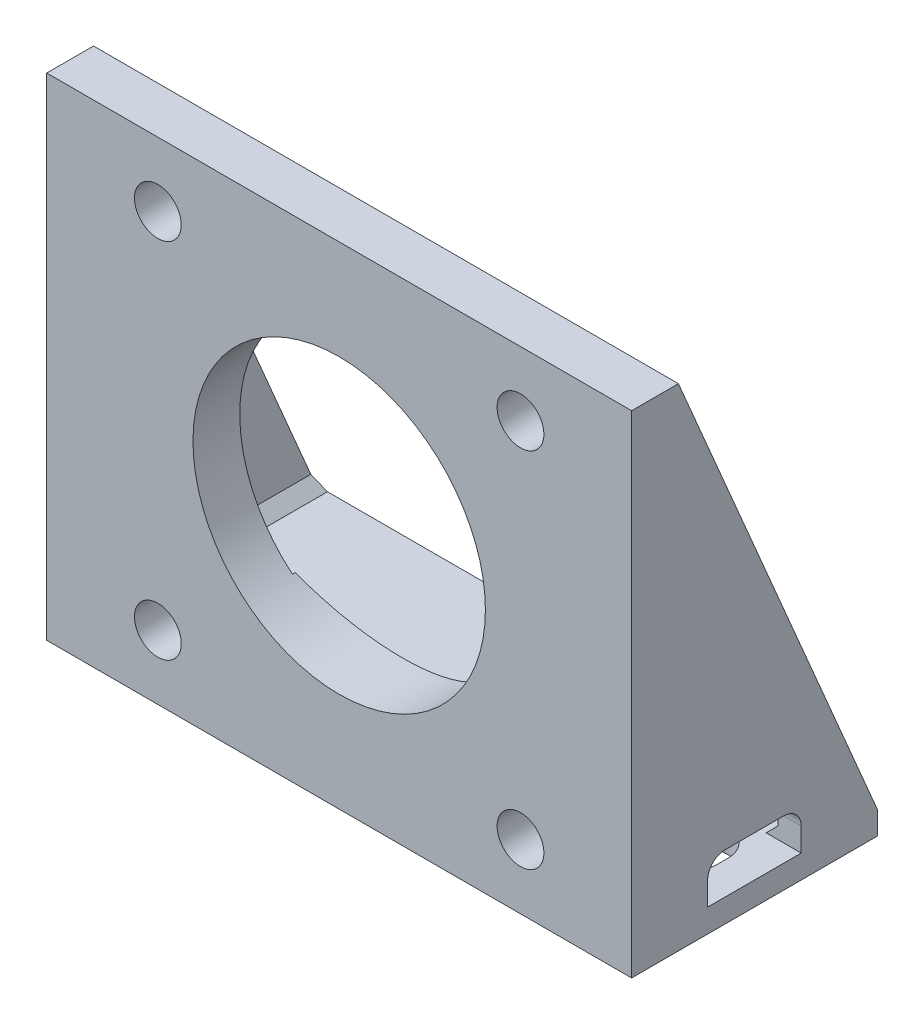
from build123d import *
from OCP.BRepFilletAPI import BRepFilletAPI_MakeChamfer

# Parameters (mm, degrees)
SKETCH1_W                = 50
SKETCH1_H                = 21
BOSS_EXTRUDE1_DEPTH      = 2
SKETCH2_W                = 50
SKETCH2_H                = 42
SKETCH2_R                = 2
SKETCH2_R_2              = 12.5
BOSS_EXTRUDE2_DEPTH      = 4
BOSS_EXTRUDE3_START      = -50
BOSS_EXTRUDE3_DEPTH      = 50
CUT_EXTRUDE1_START       = -17
SKETCH4_W                = 46
SKETCH4_H                = 40
CUT_EXTRUDE1_DEPTH       = 17
BOSS_EXTRUDE4_DEPTH      = 8
BOSS_EXTRUDE4_DEPTH_BACK = 8
SKETCH6_R                = 12.5
CUT_EXTRUDE2_DEPTH       = 68.475921631
CHAMFER1_SIZE            = 1
CHAMFER1_SIZE2           = 1.795054936
CHAMFER2_SIZE            = 2


with BuildPart() as part:
    # Sketch1 → Boss-Extrude1 (new body)
    with BuildSketch(Plane(origin=(0, 0, 0), x_dir=(1, 0, 0), z_dir=(0, 1, 0))):
        with Locations((25, 10.5)):
            Rectangle(SKETCH1_W, SKETCH1_H)
        with BuildLine():
            Line((7.25, 11), (7.25, 10))
            ThreePointArc((7.25, 10), (5, 7.75), (2.75, 10))
            Line((2.75, 10), (2.75, 11))
            ThreePointArc((2.75, 11), (5, 13.25), (7.25, 11))
        make_face(mode=Mode.SUBTRACT)
        with BuildLine():
            Line((42.75, 11), (42.75, 10))
            ThreePointArc((42.75, 10), (45, 7.75), (47.25, 10))
            Line((47.25, 10), (47.25, 11))
            ThreePointArc((47.25, 11), (45, 13.25), (42.75, 11))
        make_face(mode=Mode.SUBTRACT)
        with BuildLine():
            Line((27.25, 16), (27.25, 15))
            ThreePointArc((27.25, 15), (25, 12.75), (22.75, 15))
            Line((22.75, 15), (22.75, 16))
            ThreePointArc((22.75, 16), (25, 18.25), (27.25, 16))
        make_face(mode=Mode.SUBTRACT)
    extrude(amount=BOSS_EXTRUDE1_DEPTH)

    # Sketch2 → Boss-Extrude2 (add)
    with BuildSketch(Plane.XY):
        with Locations((25, 21)):
            Rectangle(SKETCH2_W, SKETCH2_H)
        with Locations((9.5, 36.5)):
            Circle(SKETCH2_R, mode=Mode.SUBTRACT)
        with Locations((9.5, 5.5)):
            Circle(SKETCH2_R, mode=Mode.SUBTRACT)
        with Locations((40.5, 5.5)):
            Circle(SKETCH2_R, mode=Mode.SUBTRACT)
        with Locations((40.5, 36.5)):
            Circle(SKETCH2_R, mode=Mode.SUBTRACT)
        with Locations((25, 21)):
            Circle(SKETCH2_R_2, mode=Mode.SUBTRACT)
    extrude(amount=-BOSS_EXTRUDE2_DEPTH)

    # Sketch3 → Boss-Extrude3 (add)
    with BuildSketch(Plane(origin=(50, 0, 0), x_dir=(0, 0, -1), z_dir=(1, 0, 0)).offset(BOSS_EXTRUDE3_START)):
        with BuildLine():
            Line((21, 2), (4, 42))
            Line((4, 42), (4, 2))
            Line((4, 2), (6.5, 2))
            Line((6.5, 2), (6.5, 4))
            ThreePointArc((6.5, 4), (6.939339828, 5.060660172), (8, 5.5))
            Line((8, 5.5), (13, 5.5))
            ThreePointArc((13, 5.5), (14.060660172, 5.060660172), (14.5, 4))
            Line((14.5, 4), (14.5, 2))
            Line((14.5, 2), (21, 2))
        make_face()
    extrude(amount=BOSS_EXTRUDE3_DEPTH)

    # Sketch4 → Cut-Extrude1 (cut)
    with BuildSketch(Plane(origin=(0, 0, -21), x_dir=(-1, 0, 0), z_dir=(0, 0, -1)).offset(CUT_EXTRUDE1_START)):
        with Locations((-25, 22)):
            Rectangle(SKETCH4_W, SKETCH4_H)
    extrude(amount=CUT_EXTRUDE1_DEPTH, mode=Mode.SUBTRACT)

    # Sketch5 → Boss-Extrude4 (add, two sides: drawn at the far end of the back side and taken through both)
    with BuildSketch(Plane.ZY.offset(-25).offset(-BOSS_EXTRUDE4_DEPTH_BACK)):
        Polygon((-4, 2), (-8, 2), (-4, 12), align=None)
    extrude(amount=BOSS_EXTRUDE4_DEPTH + BOSS_EXTRUDE4_DEPTH_BACK)

    # Sketch6 → Cut-Extrude2 (cut, through all)
    with BuildSketch(Plane.XY.offset(-4)):
        with Locations((25, 21)):
            Circle(SKETCH6_R)
    extrude(amount=-CUT_EXTRUDE2_DEPTH, mode=Mode.SUBTRACT)

    # Chamfer1: one chamfer whose edges measure the first distance from different faces: ONE call of the kernel's chamfer builder (chamfer() names one face for all edges)
    chamfer1_edges_1 = [part.edges().sort_by_distance(p)[0] for p in [
        (2, 2, -17.75),
        (48, 2, -17.75),
        (48, 2, -5.25),
        (40.5, 2, -4),
        (2, 2, -5.25),
        (9.5, 2, -4),
        (33, 2, -6),
        (17, 2, -6),
    ]]
    chamfer1_edges_2 = [part.edges().sort_by_distance(p)[0] for p in [
        (25, 2, -8),
    ]]
    chamfer1_side_2 = [part.faces().sort_by_distance(p)[0] for p in [
        (1, 2, -13.971890163),
    ]]
    chamfer1 = BRepFilletAPI_MakeChamfer(part.part.solid().wrapped)
    for e in chamfer1_edges_1:
        chamfer1.Add(CHAMFER1_SIZE, e.wrapped)
    for e in chamfer1_edges_2:
        chamfer1.Add(CHAMFER1_SIZE, CHAMFER1_SIZE2, e.wrapped, chamfer1_side_2[0].wrapped)  # the first distance lies on this face
    add(Compound.cast(chamfer1.Shape()), mode=Mode.REPLACE)

    # Chamfer2
    chamfer2_edges = [part.edges().sort_by_distance(p)[0] for p in [
        (48, 22.5, -4),
        (2, 22.5, -4),
    ]]
    chamfer(chamfer2_edges, length=CHAMFER2_SIZE - 0.0001)  # a hair under: the kernel refuses the full size


solid = part.part
